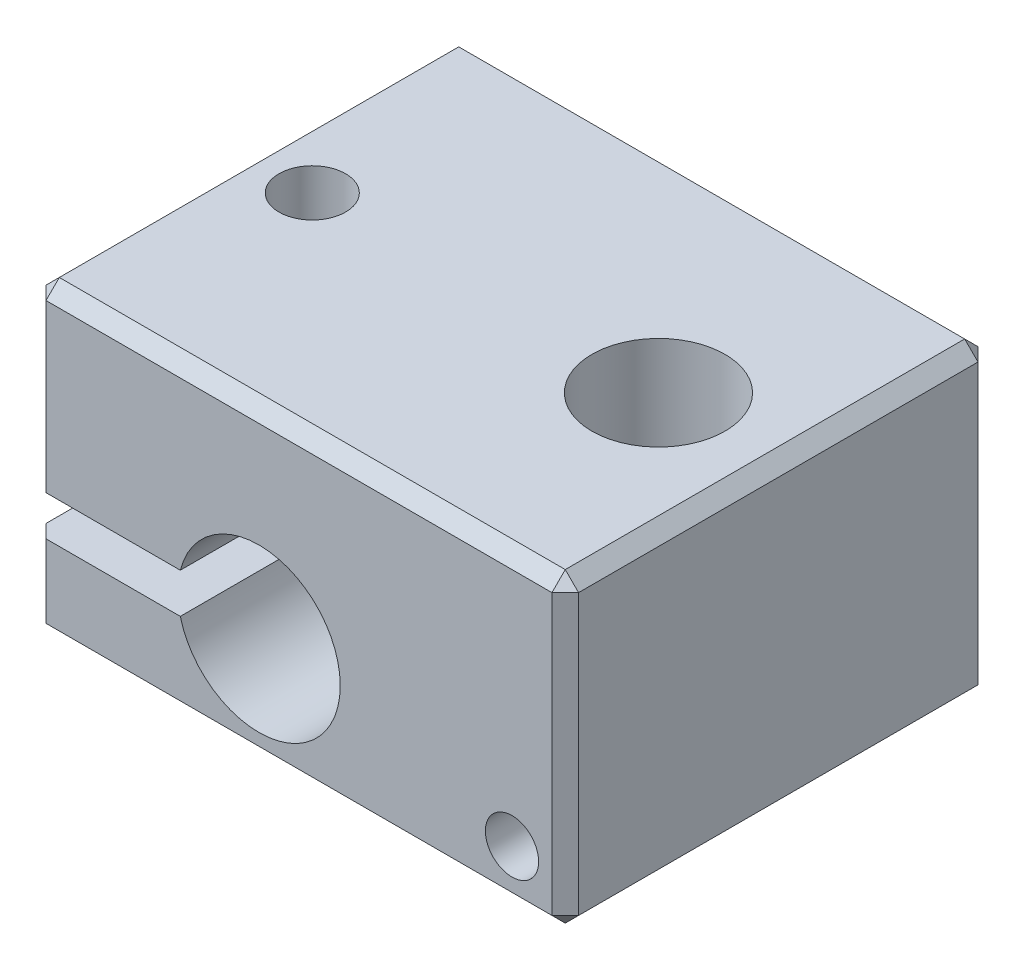
from build123d import *

# Parameters (mm, degrees)
SKETCH1_W             = 20
SKETCH1_H             = 16
BOSS_EXTRUDE1_DEPTH   = 11.5
M3X0_5_TAPPED_HOLE1_D = 2.5
M6_TAPPED_HOLE1_D     = 5
CUT_EXTRUDE1_DEPTH    = 16
SKETCH10_R            = 1
CUT_EXTRUDE2_DEPTH    = 2
SKETCH11_R            = 0.75
CUT_EXTRUDE3_DEPTH    = 2.5
CHAMFER1_SIZE         = 0.5


with BuildPart() as part:
    # Sketch1 → Boss-Extrude1 (new body)
    with BuildSketch(Plane(origin=(0, 0, 0), x_dir=(1, 0, 0), z_dir=(0, 1, 0))):
        with Locations((10, 8)):
            Rectangle(SKETCH1_W, SKETCH1_H)
    extrude(amount=BOSS_EXTRUDE1_DEPTH)

    # M3x0.5 Tapped Hole1 (through all)
    with Locations(Plane(origin=(0, 11.5, 0), x_dir=(1, 0, 0), z_dir=(0, 1, 0))):
        with Locations((2.5, 8)):
            Hole(M3X0_5_TAPPED_HOLE1_D / 2)

    # M6 Tapped Hole1 (through all)
    with Locations(Plane(origin=(0, 11.5, 0), x_dir=(1, 0, 0), z_dir=(0, 1, 0))):
        with Locations((15.5, 8)):
            Hole(M6_TAPPED_HOLE1_D / 2)

    # Sketch2 → Cut-Extrude1 (cut)
    with BuildSketch(Plane.XY):
        with BuildLine():
            Line((5.5436509, 4.75), (0, 4.75))
            Line((0, 4.75), (0, 3.25))
            Line((0, 3.25), (5.5436509, 3.25))
            ThreePointArc((5.5436509, 3.25), (11.55, 4), (5.5436509, 4.75))
        make_face()
    extrude(amount=-CUT_EXTRUDE1_DEPTH, mode=Mode.SUBTRACT)

    # Sketch10 → Cut-Extrude2 (cut)
    with BuildSketch(Plane.XY):
        with Locations((18, 2)):
            Circle(SKETCH10_R)
    extrude(amount=-CUT_EXTRUDE2_DEPTH, mode=Mode.SUBTRACT)

    # Sketch11 → Cut-Extrude3 (cut)
    with BuildSketch(Plane.XY.offset(-2)):
        with Locations((18, 2)):
            Circle(SKETCH11_R)
    extrude(amount=-CUT_EXTRUDE3_DEPTH, mode=Mode.SUBTRACT)

    # Chamfer1
    chamfer1_edges = [part.edges().sort_by_distance(p)[0] for p in [
        (0, 1.625, -16),
        (0, 8.125, -16),
        (0, 0, -8),
        (20, 11.5, -8),
        (10, 0, -16),
        (20, 5.75, -16),
        (20, 0, -8),
        (0, 1.625, 0),
        (10, 0, 0),
        (20, 5.75, 0),
        (0, 8.125, 0),
        (10, 11.5, 0),
        (0, 11.5, -8),
        (10, 11.5, -16),
    ]]
    chamfer(chamfer1_edges, length=CHAMFER1_SIZE)


solid = part.part
